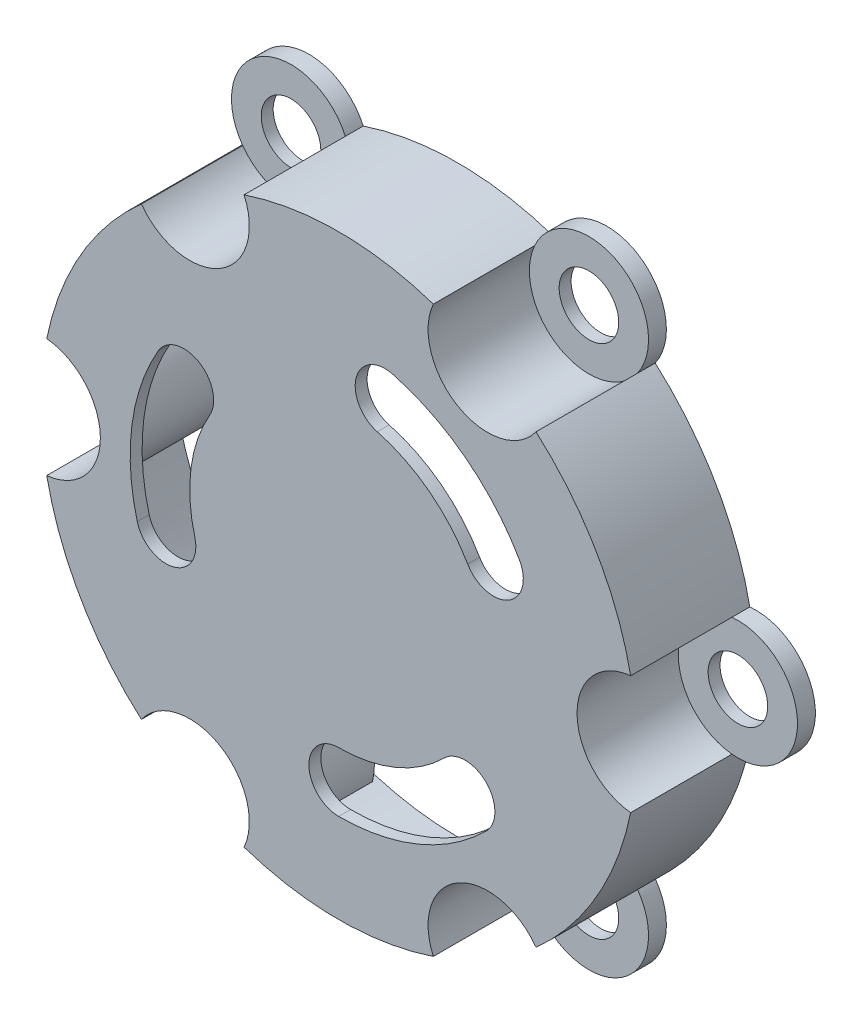
from build123d import *

# Parameters (mm, degrees)
BOSS_EXTRUDE2_DEPTH = 20
SKETCH1_3_R         = 10
SKETCH1_3_R_2       = 5
BOSS_EXTRUDE3_DEPTH = 3
SHELL1_DEPTH        = 18
SHELL1_2_OUTLINE_R  = 5
SHELL1_2_DEPTH      = 1


# Read off the part's stored shape, not the designer's step: Shell1
with BuildPart() as part:
    # Sketch1 → Boss-Extrude2 (new body)
    with BuildSketch(Plane.XY):
        with BuildLine():
            ThreePointArc((-40, 0), (-42.583801513, -6.708203932), (-49, -9.949874371))
            ThreePointArc((-49, -9.949874371), (-43.301270189, -25), (-33.11684397, -37.4603076))
            ThreePointArc((-33.11684397, -37.4603076), (-21.931485677, -33.783695926), (-15, -43.301270189))
            ThreePointArc((-15, -43.301270189), (-15.223281744, -45.402645965), (-15.88315603, -47.410181971))
            ThreePointArc((-15.88315603, -47.410181971), (0, -50), (15.88315603, -47.410181971))
            ThreePointArc((15.88315603, -47.410181971), (20, -34.641016151), (33.11684397, -37.4603076))
            ThreePointArc((33.11684397, -37.4603076), (43.301270189, -25), (49, -9.949874371))
            ThreePointArc((49, -9.949874371), (40, 0), (49, 9.949874371))
            ThreePointArc((49, 9.949874371), (43.301270189, 25), (33.11684397, 37.4603076))
            ThreePointArc((33.11684397, 37.4603076), (20, 34.641016151), (15.88315603, 47.410181971))
            ThreePointArc((15.88315603, 47.410181971), (0, 50), (-15.88315603, 47.410181971))
            ThreePointArc((-15.88315603, 47.410181971), (-15.223281744, 45.402645965), (-15, 43.301270189))
            ThreePointArc((-15, 43.301270189), (-21.931485677, 33.783695926), (-33.11684397, 37.4603076))
            ThreePointArc((-33.11684397, 37.4603076), (-43.301270189, 25), (-49, 9.949874371))
            ThreePointArc((-49, 9.949874371), (-42.583801513, 6.708203932), (-40, 0))
        make_face()
        with BuildLine():
            ThreePointArc((24.748737342, -24.748737342), (13.393920133, -32.335783638), (0, -35))
            ThreePointArc((0, -35), (-5, -30), (0, -25))
            ThreePointArc((0, -25), (9.567085809, -23.096988313), (17.67766953, -17.67766953))
            ThreePointArc((17.67766953, -17.67766953), (24.748737342, -17.67766953), (24.748737342, -24.748737342))
        make_face(mode=Mode.SUBTRACT)
        with BuildLine():
            ThreePointArc((-33.80740392, -9.058666579), (-34.700570148, 4.568416728), (-30.310889132, 17.5))
            ThreePointArc((-30.310889132, 17.5), (-23.480762114, 19.330127019), (-21.650635095, 12.5))
            ThreePointArc((-21.650635095, 12.5), (-24.786121534, 3.263154806), (-24.148145657, -6.470476128))
            ThreePointArc((-24.148145657, -6.470476128), (-27.683679563, -12.594200485), (-33.80740392, -9.058666579))
        make_face(mode=Mode.SUBTRACT)
        with BuildLine():
            ThreePointArc((9.058666579, 33.80740392), (21.306650015, 27.76736691), (30.310889132, 17.5))
            ThreePointArc((30.310889132, 17.5), (28.480762114, 10.669872981), (21.650635095, 12.5))
            ThreePointArc((21.650635095, 12.5), (15.219035725, 19.833833507), (6.470476128, 24.148145657))
            ThreePointArc((6.470476128, 24.148145657), (2.934942222, 30.271870014), (9.058666579, 33.80740392))
        make_face(mode=Mode.SUBTRACT)
    extrude(amount=BOSS_EXTRUDE2_DEPTH)

    # Sketch1<3> → Boss-Extrude3 (add)
    # profile 1 of 6: a face of its own
    with BuildSketch(Plane.XY):
        with Locations((50, 0)):
            Circle(SKETCH1_3_R)
        with Locations((50, 0)):
            Circle(SKETCH1_3_R_2, mode=Mode.SUBTRACT)
    # profile 2 of 6: a face of its own
    with BuildSketch(Plane.XY):
        with Locations((25, -43.301270189)):
            Circle(SKETCH1_3_R)
        with Locations((25, -43.301270189)):
            Circle(SKETCH1_3_R_2, mode=Mode.SUBTRACT)
    # profile 3 of 6: a face of its own
    with BuildSketch(Plane.XY):
        with Locations((-25, -43.301270189)):
            Circle(SKETCH1_3_R)
        with Locations((-25, -43.301270189)):
            Circle(SKETCH1_3_R_2, mode=Mode.SUBTRACT)
    # profile 4 of 6: a face of its own
    with BuildSketch(Plane.XY):
        with Locations((-50, 0)):
            Circle(SKETCH1_3_R)
        with Locations((-50, 0)):
            Circle(SKETCH1_3_R_2, mode=Mode.SUBTRACT)
    # profile 5 of 6: a face of its own
    with BuildSketch(Plane.XY):
        with Locations((-25, 43.301270189)):
            Circle(SKETCH1_3_R)
        with Locations((-25, 43.301270189)):
            Circle(SKETCH1_3_R_2, mode=Mode.SUBTRACT)
    # profile 6 of 6: a face of its own
    with BuildSketch(Plane.XY):
        with Locations((25, 43.301270189)):
            Circle(SKETCH1_3_R)
        with Locations((25, 43.301270189)):
            Circle(SKETCH1_3_R_2, mode=Mode.SUBTRACT)
    extrude(amount=BOSS_EXTRUDE3_DEPTH)

    # Shell1 outline → Shell1 (cut)
    with BuildSketch(Plane.XY):
        with BuildLine():
            ThreePointArc((46.6, 11.508257905), (41.569219382, 24), (33.266443699, 34.602654864))
            ThreePointArc((33.266443699, 34.602654864), (19, 32.908965344), (13.333556301, 46.110912769))
            ThreePointArc((13.333556301, 46.110912769), (0, 48), (-13.333556301, 46.110912769))
            ThreePointArc((-13.333556301, 46.110912769), (-19, 32.908965344), (-33.266443699, 34.602654864))
            ThreePointArc((-33.266443699, 34.602654864), (-41.569219382, 24), (-46.6, 11.508257905))
            ThreePointArc((-46.6, 11.508257905), (-38, 0), (-46.6, -11.508257905))
            ThreePointArc((-46.6, -11.508257905), (-41.569219382, -24), (-33.266443699, -34.602654864))
            ThreePointArc((-33.266443699, -34.602654864), (-19, -32.908965344), (-13.333556301, -46.110912769))
            ThreePointArc((-13.333556301, -46.110912769), (0, -48), (13.333556301, -46.110912769))
            ThreePointArc((13.333556301, -46.110912769), (19, -32.908965344), (33.266443699, -34.602654864))
            ThreePointArc((33.266443699, -34.602654864), (41.569219382, -24), (46.6, -11.508257905))
            ThreePointArc((46.6, -11.508257905), (38, 0), (46.6, 11.508257905))
        make_face()
        with BuildLine():
            ThreePointArc((17.67766953, -17.67766953), (24.748737342, -17.67766953), (24.748737342, -24.748737342))
            ThreePointArc((24.748737342, -24.748737342), (13.393920133, -32.335783638), (0, -35))
            ThreePointArc((0, -35), (-5, -30), (0, -25))
            ThreePointArc((0, -25), (9.567085809, -23.096988313), (17.67766953, -17.67766953))
        make_face(mode=Mode.SUBTRACT)
        with BuildLine():
            ThreePointArc((-21.650635095, 12.5), (-24.786121534, 3.263154805), (-24.148145657, -6.470476128))
            ThreePointArc((-24.148145657, -6.470476128), (-27.683679563, -12.594200485), (-33.80740392, -9.058666579))
            ThreePointArc((-33.80740392, -9.058666579), (-34.700570148, 4.568416728), (-30.310889132, 17.5))
            ThreePointArc((-30.310889132, 17.5), (-23.480762113, 19.330127019), (-21.650635095, 12.5))
        make_face(mode=Mode.SUBTRACT)
        with BuildLine():
            ThreePointArc((6.470476128, 24.148145657), (2.934942222, 30.271870014), (9.058666579, 33.80740392))
            ThreePointArc((9.058666579, 33.80740392), (21.306650015, 27.76736691), (30.310889132, 17.5))
            ThreePointArc((30.310889132, 17.5), (28.480762114, 10.669872981), (21.650635095, 12.5))
            ThreePointArc((21.650635095, 12.5), (15.219035725, 19.833833507), (6.470476128, 24.148145657))
        make_face(mode=Mode.SUBTRACT)
    extrude(amount=SHELL1_DEPTH, mode=Mode.SUBTRACT)

    # Shell1 2 outline → Shell1 2 (cut)
    # profile 1 of 6: a face of its own
    with BuildSketch(Plane.XY):
        with BuildLine():
            ThreePointArc((13.333556301, 46.110912769), (19, 32.908965344), (33.266443699, 34.602654864))
            ThreePointArc((33.266443699, 34.602654864), (31.787193359, 35.966294477), (30.2520989, 37.266748076))
            ThreePointArc((30.2520989, 37.266748076), (29, 50.229473419), (17.1479011, 44.832460203))
            ThreePointArc((17.1479011, 44.832460203), (15.254128017, 45.511664202), (13.333556301, 46.110912769))
        make_face()
        with Locations((25, 43.301270189)):
            Circle(SHELL1_2_OUTLINE_R, mode=Mode.SUBTRACT)
    # profile 2 of 6: a face of its own
    with BuildSketch(Plane.XY):
        with BuildLine():
            ThreePointArc((47.4, 7.565712128), (47.041321376, 9.545369726), (46.6, 11.508257905))
            ThreePointArc((46.6, 11.508257905), (38, 0), (46.6, -11.508257905))
            ThreePointArc((46.6, -11.508257905), (47.041321376, -9.545369726), (47.4, -7.565712128))
            ThreePointArc((47.4, -7.565712128), (58, 0), (47.4, 7.565712128))
        make_face()
        with Locations((50, 0)):
            Circle(SHELL1_2_OUTLINE_R, mode=Mode.SUBTRACT)
    # profile 3 of 6: a face of its own
    with BuildSketch(Plane.XY):
        with BuildLine():
            ThreePointArc((-33.266443699, 34.602654864), (-19, 32.908965344), (-13.333556301, 46.110912769))
            ThreePointArc((-13.333556301, 46.110912769), (-15.254128017, 45.511664202), (-17.1479011, 44.832460203))
            ThreePointArc((-17.1479011, 44.832460203), (-29, 50.229473419), (-30.2520989, 37.266748076))
            ThreePointArc((-30.2520989, 37.266748076), (-31.787193359, 35.966294477), (-33.266443699, 34.602654864))
        make_face()
        with Locations((-25, 43.301270189)):
            Circle(SHELL1_2_OUTLINE_R, mode=Mode.SUBTRACT)
    # profile 4 of 6: a face of its own
    with BuildSketch(Plane.XY):
        with BuildLine():
            ThreePointArc((30.2520989, -37.266748076), (31.787193359, -35.966294477), (33.266443699, -34.602654864))
            ThreePointArc((33.266443699, -34.602654864), (19, -32.908965344), (13.333556301, -46.110912769))
            ThreePointArc((13.333556301, -46.110912769), (15.254128017, -45.511664202), (17.1479011, -44.832460203))
            ThreePointArc((17.1479011, -44.832460203), (29, -50.229473419), (30.2520989, -37.266748076))
        make_face()
        with Locations((25, -43.301270189)):
            Circle(SHELL1_2_OUTLINE_R, mode=Mode.SUBTRACT)
    # profile 5 of 6: a face of its own
    with BuildSketch(Plane.XY):
        with BuildLine():
            ThreePointArc((-46.6, -11.508257905), (-38, 0), (-46.6, 11.508257905))
            ThreePointArc((-46.6, 11.508257905), (-47.041321376, 9.545369726), (-47.4, 7.565712128))
            ThreePointArc((-47.4, 7.565712128), (-58, 0), (-47.4, -7.565712128))
            ThreePointArc((-47.4, -7.565712128), (-47.041321376, -9.545369726), (-46.6, -11.508257905))
        make_face()
        with Locations((-50, 0)):
            Circle(SHELL1_2_OUTLINE_R, mode=Mode.SUBTRACT)
    # profile 6 of 6: a face of its own
    with BuildSketch(Plane.XY):
        with BuildLine():
            ThreePointArc((-17.1479011, -44.832460203), (-15.254128017, -45.511664202), (-13.333556301, -46.110912769))
            ThreePointArc((-13.333556301, -46.110912769), (-19, -32.908965344), (-33.266443699, -34.602654864))
            ThreePointArc((-33.266443699, -34.602654864), (-31.787193359, -35.966294477), (-30.2520989, -37.266748076))
            ThreePointArc((-30.2520989, -37.266748076), (-29, -50.229473419), (-17.1479011, -44.832460203))
        make_face()
        with Locations((-25, -43.301270189)):
            Circle(SHELL1_2_OUTLINE_R, mode=Mode.SUBTRACT)
    extrude(amount=SHELL1_2_DEPTH, mode=Mode.SUBTRACT)


solid = part.part
